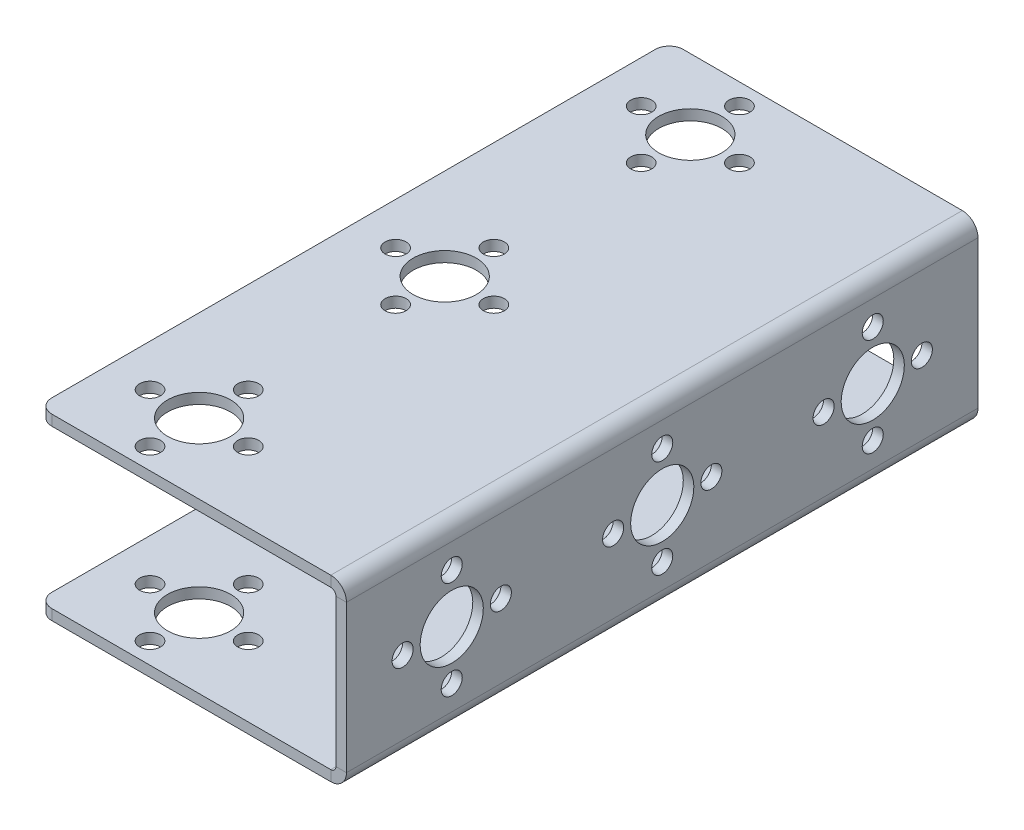
from build123d import *

# Parameters (mm, degrees)
SKETCH1_W                    = 44
SKETCH1_H                    = 90
BASE_FLANGE1_DEPTH           = 1.5
EDGE_FLANGE1_STRIP_W         = 7.4732
EDGE_FLANGE1_STRIP_H         = 1.5
EDGE_FLANGE1_STRIP_CUT_DEPTH = 90
EDGE_FLANGE1_DEPTH           = 90
EDGE_FLANGE2_STRIP_W         = 7.4732
EDGE_FLANGE2_STRIP_H         = 1.5
EDGE_FLANGE2_STRIP_CUT_DEPTH = 90
EDGE_FLANGE2_DEPTH           = 90
SKETCH12_R                   = 4.5
SKETCH12_R_2                 = 1.5
CUT_EXTRUDE4_DEPTH           = 68.906185285
SKETCH13_R                   = 4.5
SKETCH13_R_2                 = 1.5
CUT_EXTRUDE5_DEPTH           = 10
LPATTERN1_COUNT              = 2
LPATTERN1_PITCH              = 30
LPATTERN1_COL_COUNT          = 2
LPATTERN1_COL_PITCH          = 30
FILLET1_R                    = 2


# Sheet-metal steps are written as plain solids
with BuildPart() as part:
    # Sketch1 → Base-Flange1 (new body)
    with BuildSketch(Plane(origin=(0, 0, 0), x_dir=(1, 0, 0), z_dir=(0, 1, 0))):
        with Locations((-22, 0)):
            Rectangle(SKETCH1_W, SKETCH1_H)
    extrude(amount=BASE_FLANGE1_DEPTH)

    # Edge-Flange1 strip (across the edge) → Edge-Flange1 strip cut (cut)
    with BuildSketch(Plane(origin=(0, 1.5, 45), x_dir=(-1, 0, 0), z_dir=(0, 0, -1))):
        with Locations((-1.5, -0.75)):
            Rectangle(EDGE_FLANGE1_STRIP_W, EDGE_FLANGE1_STRIP_H)
    extrude(amount=EDGE_FLANGE1_STRIP_CUT_DEPTH, mode=Mode.SUBTRACT)

    # Edge-Flange1 section (across the edge) → Edge-Flange1 (add)
    with BuildSketch(Plane(origin=(0, 1.5, 45), x_dir=(-1, 0, 0), z_dir=(0, 0, -1))):
        with BuildLine():
            Line((0, 0.7366), (0, 24))
            Line((0, 24), (1.5, 24))
            Line((1.5, 24), (1.5, 0.7366))
            ThreePointArc((1.5, 0.7366), (1.715745145, 0.215745145), (2.2366, 0))
            Line((2.2366, 0), (2.2366, -1.5))
            ThreePointArc((2.2366, -1.5), (0.655084973, -0.844915027), (0, 0.7366))
        make_face()
    extrude(amount=EDGE_FLANGE1_DEPTH)

    # Edge-Flange2 strip (across the edge) → Edge-Flange2 strip cut (cut)
    with BuildSketch(Plane(origin=(-1.5, 25.5, 45), x_dir=(0, -1, 0), z_dir=(0, 0, -1))):
        with Locations((-1.5, -0.75)):
            Rectangle(EDGE_FLANGE2_STRIP_W, EDGE_FLANGE2_STRIP_H)
    extrude(amount=EDGE_FLANGE2_STRIP_CUT_DEPTH, mode=Mode.SUBTRACT)

    # Edge-Flange2 section (across the edge) → Edge-Flange2 (add)
    with BuildSketch(Plane(origin=(-1.5, 25.5, 45), x_dir=(0, -1, 0), z_dir=(0, 0, -1))):
        with BuildLine():
            Line((0, 0.7366), (0, 42.5))
            Line((0, 42.5), (1.5, 42.5))
            Line((1.5, 42.5), (1.5, 0.7366))
            ThreePointArc((1.5, 0.7366), (1.715745145, 0.215745145), (2.2366, 0))
            Line((2.2366, 0), (2.2366, -1.5))
            ThreePointArc((2.2366, -1.5), (0.655084973, -0.844915027), (0, 0.7366))
        make_face()
    extrude(amount=EDGE_FLANGE2_DEPTH)

    # Sketch12 → Cut-Extrude4 (cut, through all)
    with BuildSketch(Plane(origin=(0, 0, 0), x_dir=(1, 0, 0), z_dir=(0, 1, 0))):
        with Locations((-31, 35)):
            Circle(SKETCH12_R)
        with Locations((-31, 42)):
            Circle(SKETCH12_R_2)
        with Locations((-31, 28)):
            Circle(SKETCH12_R_2)
        with Locations((-24, 35)):
            Circle(SKETCH12_R_2)
        with Locations((-38, 35)):
            Circle(SKETCH12_R_2)
        with Locations((-31, 0)):
            Circle(SKETCH12_R)
        with Locations((-31, 7)):
            Circle(SKETCH12_R_2)
        with Locations((-31, -7)):
            Circle(SKETCH12_R_2)
        with Locations((-24, 0)):
            Circle(SKETCH12_R_2)
        with Locations((-38, 0)):
            Circle(SKETCH12_R_2)
        with Locations((-31, -35)):
            Circle(SKETCH12_R)
        with Locations((-31, -28)):
            Circle(SKETCH12_R_2)
        with Locations((-24, -35)):
            Circle(SKETCH12_R_2)
        with Locations((-38, -35)):
            Circle(SKETCH12_R_2)
        with Locations((-31, -42)):
            Circle(SKETCH12_R_2)
    extrude(amount=CUT_EXTRUDE4_DEPTH, mode=Mode.SUBTRACT)

    # Sketch13 → Cut-Extrude5 (cut)
    with BuildSketch(Plane.ZY.offset(1.5)):
        with Locations(Location((0, 12.75, 0), (0, 0, 270))):
            Circle(SKETCH13_R)
        with Locations(Location((0, 19.75, 0), (0, 0, 270))):
            Circle(SKETCH13_R_2)
        with Locations(Location((0, 5.75, 0), (0, 0, 270))):
            Circle(SKETCH13_R_2)
        with Locations(Location((7, 12.75, 0), (0, 0, 270))):
            Circle(SKETCH13_R_2)
        with Locations(Location((-7, 12.75, 0), (0, 0, 270))):
            Circle(SKETCH13_R_2)
    cut_extrude5 = extrude(amount=-CUT_EXTRUDE5_DEPTH, mode=Mode.SUBTRACT)

    # LPattern1: Cut-Extrude5 ×2
    with Locations(*[(0, 0, -i * LPATTERN1_PITCH) for i in range(1, LPATTERN1_COUNT)]):
        add(cut_extrude5, mode=Mode.SUBTRACT)

    # LPattern1 col: Cut-Extrude5 ×2
    with Locations(*[(0, 0, i * LPATTERN1_COL_PITCH) for i in range(1, LPATTERN1_COL_COUNT)]):
        add(cut_extrude5, mode=Mode.SUBTRACT)

    # Fillet1
    fillet1_edges = [part.edges().sort_by_distance(p)[0] for p in [
        (-44, 24.75, 45),
        (-44, 24.75, -45),
        (-44, 0.75, 45),
        (-44, 0.75, -45),
    ]]
    fillet(fillet1_edges, radius=FILLET1_R)


solid = part.part
